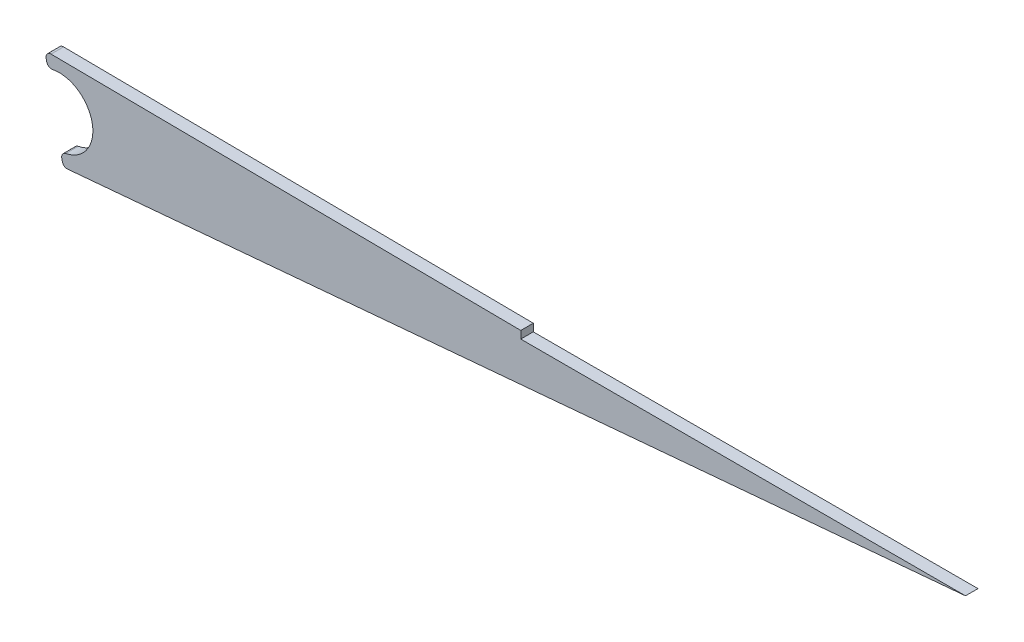
from build123d import *

# Parameters (mm, degrees)
SM_BASE_FLANGE_1_DEPTH = 5


# Sheet-metal steps are written as plain solids
with BuildPart() as part:
    # Sketch 1 → Базовая кромка1 (new body)
    with BuildSketch(Plane.XY):
        with BuildLine():
            Line((1.279191503, -33.168907268), (1.064618958, -32.092874536))
            ThreePointArc((1.064618958, -32.092874536), (1.362719913, -30.59112672), (2.635550334, -29.740236948))
            ThreePointArc((2.635550334, -29.740236948), (13.239337122, -13.859933227), (-2.644582905, -3.261564244))
            ThreePointArc((-2.644582905, -3.261564244), (-4.146432324, -2.963975592), (-4.997756242, -1.691435506))
            Line((-4.997756242, -1.691435506), (-5.212328788, -0.615402774))
            ThreePointArc((-5.212328788, -0.615402774), (-4.791260853, 1.051425345), (-3.232048448, 1.775628952))
            Line((-3.232048448, 1.775628952), (184.68601887, 0))
            Line((184.68601887, 0), (184.68601887, -3))
            Line((184.68601887, -3), (362.597814819, -3))
            Line((362.597814819, -3), (3.416789292, -34.770008252))
            ThreePointArc((3.416789292, -34.770008252), (2.041580213, -34.378539846), (1.279191503, -33.168907268))
        make_face()
    extrude(amount=-SM_BASE_FLANGE_1_DEPTH)


solid = part.part
